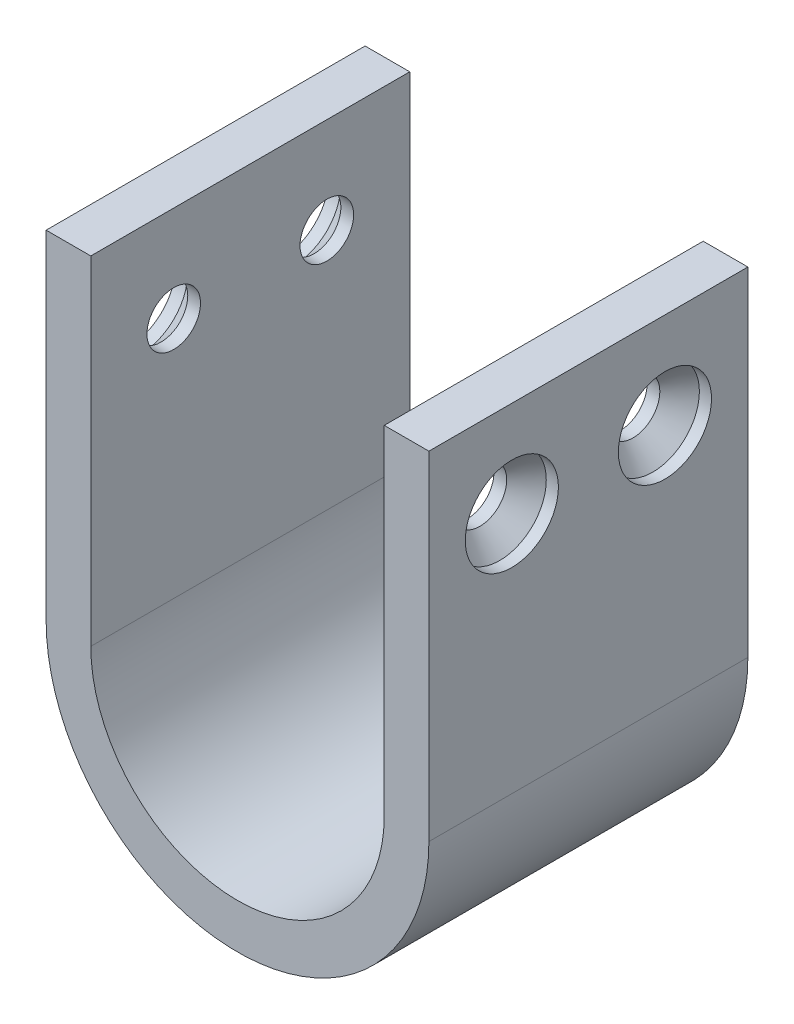
from build123d import *

# Parameters (mm, degrees)
EXTRUDE_1391_DEPTH               = 25
CUT_EXTRUDE_1919_REACH           = 49.194
SKETCH_1505_R                    = 2.1
SKETCH_2_3_R                     = 3.65
SKETCH_2_3_R_2                   = 2.1
CUT_EXTRUDE_1959_DEPTH           = 0.5
CHAMFER_2009_SIZE                = 2
CHAMFER_2009_OF_MIRROR_2081_SIZE = 2


with BuildPart() as part:
    # Sketch 313 → Extrude 1391 (new body)
    with BuildSketch(Plane.XY):
        with BuildLine():
            Line((-11.5, 0), (-11.5, 26.5))
            Line((-11.5, 26.5), (-15, 26.5))
            Line((-15, 26.5), (-15, 0))
            ThreePointArc((-15, 0), (0, -15), (15, 0))
            Line((15, 0), (15, 26.5))
            Line((15, 26.5), (11.5, 26.5))
            Line((11.5, 26.5), (11.5, 0))
            ThreePointArc((11.5, 0), (0, -11.5), (-11.5, 0))
        make_face()
    extrude(amount=EXTRUDE_1391_DEPTH)

    # Sketch 1505 → Cut-Extrude 1919 (cut, up to next)
    with BuildSketch(Plane.ZY.offset(15), mode=Mode.PRIVATE) as cut_extrude_1919_sk1:
        with Locations((6.5, 19)):
            Circle(SKETCH_1505_R)
    cut_extrude_1919_tool1 = extrude(cut_extrude_1919_sk1.sketch, amount=-CUT_EXTRUDE_1919_REACH, mode=Mode.PRIVATE) & part.part
    # Sketch 1505 → Cut-Extrude 1919 (cut, up to next)
    with BuildSketch(Plane.ZY.offset(15), mode=Mode.PRIVATE) as cut_extrude_1919_sk2:
        with Locations((18.5, 19)):
            Circle(SKETCH_1505_R)
    cut_extrude_1919_tool2 = extrude(cut_extrude_1919_sk2.sketch, amount=-CUT_EXTRUDE_1919_REACH, mode=Mode.PRIVATE) & part.part
    cut_extrude_1919_1 = cut_extrude_1919_tool1.solids().sort_by_distance((-15, 19, 6.5))[0]
    add(cut_extrude_1919_1, mode=Mode.SUBTRACT)
    cut_extrude_1919_2 = cut_extrude_1919_tool2.solids().sort_by_distance((-15, 19, 18.5))[0]
    add(cut_extrude_1919_2, mode=Mode.SUBTRACT)
    cut_extrude_1919 = cut_extrude_1919_1 + cut_extrude_1919_2  # Cut-Extrude 1919 as one shape, for the pattern or mirror that repeats it

    # Эскиз2<3> → Cut-Extrude 1959 (cut)
    # profile 1 of 2: a face of its own
    with BuildSketch(Plane.ZY.offset(15)):
        with Locations((6.5, 19)):
            Circle(SKETCH_2_3_R)
        with Locations((6.5, 19)):
            Circle(SKETCH_2_3_R_2, mode=Mode.SUBTRACT)
    # profile 2 of 2: a face of its own
    with BuildSketch(Plane.ZY.offset(15)):
        with Locations(Location((18.5, 19, 0), (0, 0, 180))):
            Circle(SKETCH_2_3_R)
        with Locations((18.5, 19)):
            Circle(SKETCH_2_3_R_2, mode=Mode.SUBTRACT)
    cut_extrude_1959 = extrude(amount=-CUT_EXTRUDE_1959_DEPTH, mode=Mode.SUBTRACT)

    # Chamfer 2009
    # the kernel refuses this chamfer: 2 mm, written as the material it takes off along each edge
    with BuildSketch(Plane(origin=(-14.5, 19, 18.5), x_dir=(0, 0, 1), z_dir=(0, -1, 0))) as chamfer_2009_piece_1_section:
        Polygon((2.1, -CHAMFER_2009_SIZE), (2.1 + CHAMFER_2009_SIZE, 0), (2.1, 0), align=None)
    chamfer_2009_piece_1 = revolve(axis=Axis((-14.5, 19, 18.5), (-1, 0, 0)), mode=Mode.PRIVATE)
    chamfer_2009_piece_1 = chamfer_2009_piece_1 & Plane(origin=(-13.269804267, 19, 18.5), x_dir=(0, 0, -1), z_dir=(-1, 0, 0)) * Cylinder(3.65, 17, mode=Mode.PRIVATE)
    add(chamfer_2009_piece_1, mode=Mode.SUBTRACT)
    with BuildSketch(Plane(origin=(-14.5, 19, 6.5), x_dir=(0, 0, 1), z_dir=(0, -1, 0))) as chamfer_2009_piece_2_section:
        Polygon((2.1, -CHAMFER_2009_SIZE), (2.1 + CHAMFER_2009_SIZE, 0), (2.1, 0), align=None)
    chamfer_2009_piece_2 = revolve(axis=Axis((-14.5, 19, 6.5), (-1, 0, 0)), mode=Mode.PRIVATE)
    chamfer_2009_piece_2 = chamfer_2009_piece_2 & Plane(origin=(-13.269804267, 19, 6.5), x_dir=(0, 0, 1), z_dir=(-1, 0, 0)) * Cylinder(3.65, 17, mode=Mode.PRIVATE)
    add(chamfer_2009_piece_2, mode=Mode.SUBTRACT)

    # Mirror 2081: Cut-Extrude 1919, Cut-Extrude 1959 across plane
    add(cut_extrude_1919.mirror(Plane(origin=(0, 0, 0), x_dir=(0, 0, 1), z_dir=(1, 0, 0))), mode=Mode.SUBTRACT)
    add(cut_extrude_1959.mirror(Plane(origin=(0, 0, 0), x_dir=(0, 0, 1), z_dir=(1, 0, 0))), mode=Mode.SUBTRACT)

    # Chamfer 2009 of Mirror 2081
    # the kernel refuses this chamfer: 2 mm, written as the material it takes off along each edge
    with BuildSketch(Plane(origin=(14.5, 19, 18.5), x_dir=(0, 0, 1), z_dir=(0, -1, 0))) as chamfer_2009_of_mirror_2081_piece_1_section:
        Polygon((2.1, CHAMFER_2009_OF_MIRROR_2081_SIZE), (2.1 + CHAMFER_2009_OF_MIRROR_2081_SIZE, 0), (2.1, 0), align=None)
    chamfer_2009_of_mirror_2081_piece_1 = revolve(axis=Axis((14.5, 19, 18.5), (-1, 0, 0)), mode=Mode.PRIVATE)
    chamfer_2009_of_mirror_2081_piece_1 = chamfer_2009_of_mirror_2081_piece_1 & Plane(origin=(13.269804267, 19, 18.5), x_dir=(0, 0, -1), z_dir=(1, 0, 0)) * Cylinder(3.65, 17, mode=Mode.PRIVATE)
    add(chamfer_2009_of_mirror_2081_piece_1, mode=Mode.SUBTRACT)
    with BuildSketch(Plane(origin=(14.5, 19, 6.5), x_dir=(0, 0, 1), z_dir=(0, -1, 0))) as chamfer_2009_of_mirror_2081_piece_2_section:
        Polygon((2.1, CHAMFER_2009_OF_MIRROR_2081_SIZE), (2.1 + CHAMFER_2009_OF_MIRROR_2081_SIZE, 0), (2.1, 0), align=None)
    chamfer_2009_of_mirror_2081_piece_2 = revolve(axis=Axis((14.5, 19, 6.5), (-1, 0, 0)), mode=Mode.PRIVATE)
    chamfer_2009_of_mirror_2081_piece_2 = chamfer_2009_of_mirror_2081_piece_2 & Plane(origin=(13.269804267, 19, 6.5), x_dir=(0, 0, 1), z_dir=(1, 0, 0)) * Cylinder(3.65, 17, mode=Mode.PRIVATE)
    add(chamfer_2009_of_mirror_2081_piece_2, mode=Mode.SUBTRACT)


solid = part.part
